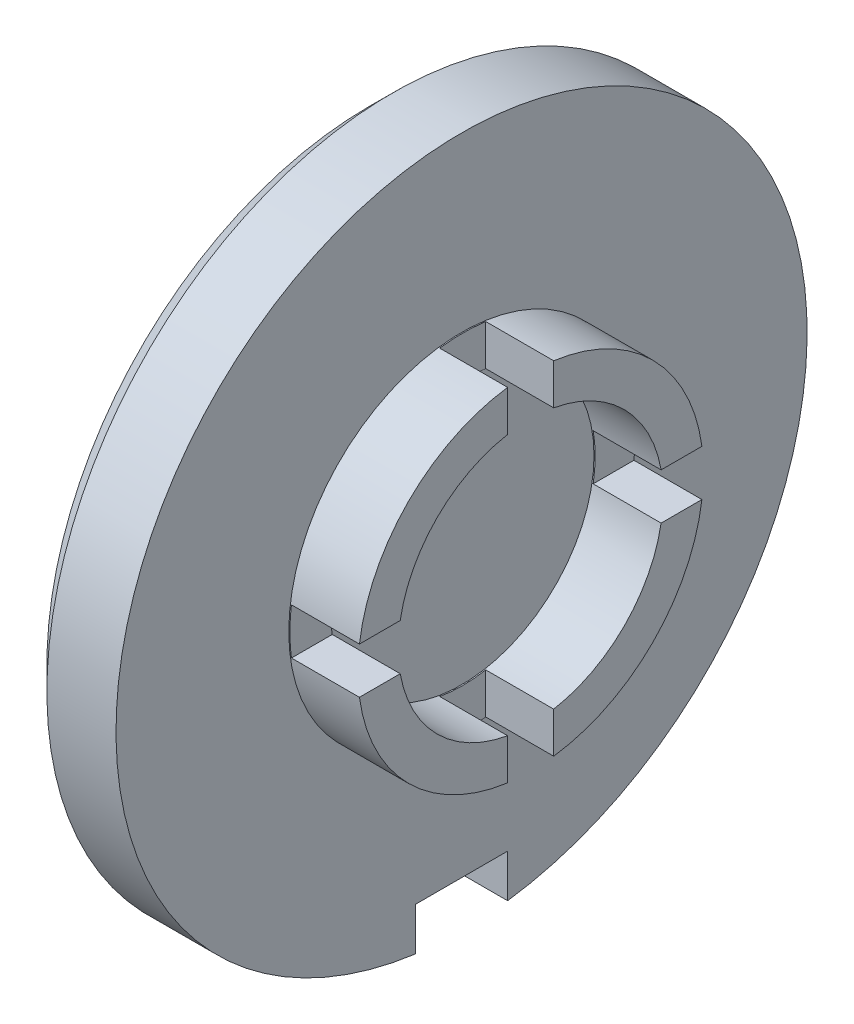
from build123d import *

# Parameters (mm, degrees)
BOSS_EXTRUDE1_START = -55.2
SKETCH2_W           = 1.28
SKETCH2_H           = 0.8
BOSS_EXTRUDE1_DEPTH = 6.4
BOSS_EXTRUDE2_START = -52.4
SKETCH3_W           = 1.28
SKETCH3_H           = 6.4
BOSS_EXTRUDE2_DEPTH = 0.8
BOSS_EXTRUDE3_START = -52.8
SKETCH4_W           = 1.8
SKETCH4_H           = 0.9
BOSS_EXTRUDE3_DEPTH = 1.6


with BuildPart() as part:
    # Sketch1 → Revolve1 (revolve)
    with BuildSketch(Plane.XY.offset(-52)):
        Polygon((-74, -17.7), (-75.2, -17.7), (-75.2, -20), (-76.8, -20), (-76.8, -14.4), (-76.4, -14), (-75.2, -14), (-75.2, -17), (-74, -17), align=None)
    revolve(axis=Axis((-81.8, -20, -52), (1, 0, 0)))


with BuildPart() as body_2:
    # Sketch2 → Boss-Extrude1 (new body)
    with BuildSketch(Plane.XY.offset(BOSS_EXTRUDE1_START)):
        with Locations((-74.54, -20)):
            Rectangle(SKETCH2_W, SKETCH2_H)
    extrude(amount=BOSS_EXTRUDE1_DEPTH)


with BuildPart() as part_1:
    add(part.part)

    # Combine1: cut body 2
    add(body_2.part, mode=Mode.SUBTRACT)


with BuildPart() as body_2_2:
    # Sketch3 → Boss-Extrude2 (new body)
    with BuildSketch(Plane.XY.offset(BOSS_EXTRUDE2_START)):
        with Locations((-74.54, -20)):
            Rectangle(SKETCH3_W, SKETCH3_H)
    extrude(amount=BOSS_EXTRUDE2_DEPTH)


with BuildPart() as part_2:
    add(part_1.part)

    # Combine2: cut body 2 2
    add(body_2_2.part, mode=Mode.SUBTRACT)


with BuildPart() as body_2_3:
    # Sketch4 → Boss-Extrude3 (new body)
    with BuildSketch(Plane.XY.offset(BOSS_EXTRUDE3_START)):
        with Locations((-76, -25.65)):
            Rectangle(SKETCH4_W, SKETCH4_H)
    extrude(amount=BOSS_EXTRUDE3_DEPTH)


with BuildPart() as part_3:
    add(part_2.part)

    # Combine3: cut body 2 3
    add(body_2_3.part, mode=Mode.SUBTRACT)


solid = part_3.part
